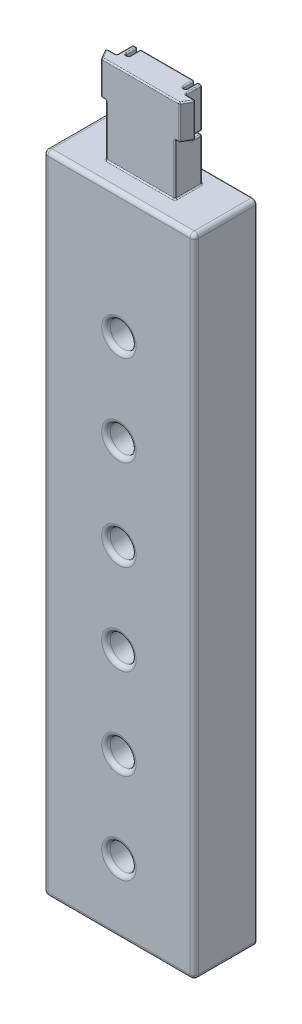
from build123d import *

# Parameters (mm, degrees)
SKETCH1_R               = 18
BOSS_EXTRUDE1_DEPTH     = 19
BOSS_EXTRUDE2_START     = -14.5
BOSS_EXTRUDE2_DEPTH     = 14.5
CUT_EXTRUDE2_DEPTH      = 194.386271488
CUT_EXTRUDE2_DEPTH_BACK = 194.386271488
SKETCH4_R               = 3
SKETCH5_R               = 2.25
CUT_EXTRUDE3_DEPTH      = 3
SKETCH6_R               = 1.65
CUT_EXTRUDE4_DEPTH      = 194.775643464
SKETCH7_R               = 2.95
CUT_EXTRUDE5_DEPTH      = 17
CUT_EXTRUDE7_DEPTH      = 194.386271488
CUT_EXTRUDE7_DEPTH_BACK = 194.386271488
SKETCH8_OUTSIDE_W       = 80.782
SKETCH8_OUTSIDE_H       = 254.782
CUT_EXTRUDE8_DEPTH      = 194.340373435
CUT_EXTRUDE8_DEPTH_BACK = 5
SKETCH9_W               = 16
SKETCH9_H               = 20
SKETCH18_W              = 16
SKETCH18_H              = 20
CUT_EXTRUDE13_DEPTH     = 3.2
BOSS_EXTRUDE3_DEPTH     = 8
SKETCH16_W              = 0.75
SKETCH16_H              = 6
CUT_EXTRUDE11_DEPTH     = 10
SKETCH17_W              = 6
SKETCH17_H              = 0.75
CUT_EXTRUDE12_DEPTH     = 1.75
FILLET2_R               = 0.3
FILLET1_R               = 1


with BuildPart() as part:
    # Sketch1 → Boss-Extrude1 (new body)
    with BuildSketch(Plane.XY):
        Circle(SKETCH1_R)
    extrude(amount=BOSS_EXTRUDE1_DEPTH)

    # Sketch3 → Boss-Extrude2 (add)
    with BuildSketch(Plane.XY.offset(19).offset(BOSS_EXTRUDE2_START)):
        with BuildLine():
            Line((-17.5, -4.213074887), (-17.5, -192))
            Line((-17.5, -192), (17.5, -192))
            Line((17.5, -192), (17.5, -4.213074887))
            ThreePointArc((17.5, -4.213074887), (0, -18), (-17.5, -4.213074887))
        make_face()
    extrude(amount=BOSS_EXTRUDE2_DEPTH)

    # Sketch4 → Cut-Extrude2 (cut, two sides: drawn at the far end of the back side and taken through both)
    with BuildSketch(Plane(origin=(0, 0, 4.5), x_dir=(-1, 0, 0), z_dir=(0, 0, -1)).offset(-CUT_EXTRUDE2_DEPTH_BACK)):
        with Locations((0, -71)):
            Circle(SKETCH4_R)
        with Locations((0, -92)):
            Circle(SKETCH4_R)
        with Locations((0, -113)):
            Circle(SKETCH4_R)
        with Locations((0, -134)):
            Circle(SKETCH4_R)
        with Locations((0, -155)):
            Circle(SKETCH4_R)
        with Locations((0, -176)):
            Circle(SKETCH4_R)
    extrude(amount=CUT_EXTRUDE2_DEPTH + CUT_EXTRUDE2_DEPTH_BACK, mode=Mode.SUBTRACT)

    # Sketch5 → Cut-Extrude3 (cut)
    with BuildSketch(Plane(origin=(0, 0, 0), x_dir=(-1, 0, 0), z_dir=(0, 0, -1))):
        with Locations((-6, 10.392304845)):
            Circle(SKETCH5_R)
        with Locations((12, 0)):
            Circle(SKETCH5_R)
        with Locations((-6, -10.392304845)):
            Circle(SKETCH5_R)
    extrude(amount=-CUT_EXTRUDE3_DEPTH, mode=Mode.SUBTRACT)

    # Sketch6 → Cut-Extrude4 (cut, through all)
    with BuildSketch(Plane(origin=(0, 0, 0), x_dir=(-1, 0, 0), z_dir=(0, 0, -1))):
        with Locations((0, 13.5)):
            Circle(SKETCH6_R)
        with Locations((11.691342951, 6.75)):
            Circle(SKETCH6_R)
        with Locations((11.691342951, -6.75)):
            Circle(SKETCH6_R)
        with Locations((0, -13.5)):
            Circle(SKETCH6_R)
        with Locations((-11.691342951, -6.75)):
            Circle(SKETCH6_R)
        with Locations((-11.691342951, 6.75)):
            Circle(SKETCH6_R)
    extrude(amount=-CUT_EXTRUDE4_DEPTH, mode=Mode.SUBTRACT)

    # Sketch7 → Cut-Extrude5 (cut)
    with BuildSketch(Plane.XY.offset(19)):
        with Locations((0, 13.5)):
            Circle(SKETCH7_R)
        with Locations((11.691342951, 6.75)):
            Circle(SKETCH7_R)
        with Locations((11.691342951, -6.75)):
            Circle(SKETCH7_R)
        with Locations((0, -13.5)):
            Circle(SKETCH7_R)
        with Locations((-11.691342951, -6.75)):
            Circle(SKETCH7_R)
        with Locations((-11.691342951, 6.75)):
            Circle(SKETCH7_R)
    extrude(amount=-CUT_EXTRUDE5_DEPTH, mode=Mode.SUBTRACT)

    # Sketch8 outside → Cut-Extrude7 (cut, two sides: drawn at the far end of the back side and taken through both)
    with BuildSketch(Plane(origin=(0, 0, 4.5), x_dir=(-1, 0, 0), z_dir=(0, 0, -1)).offset(-CUT_EXTRUDE7_DEPTH_BACK)):
        with Locations((0, -87)):
            Rectangle(SKETCH8_OUTSIDE_W, SKETCH8_OUTSIDE_H)
        Polygon((-17.5, -192), (17.5, -192), (17.5, -42), (8, -42), (8, -22), (-8, -22), (-8, -42), (-17.5, -42), align=None, mode=Mode.SUBTRACT)
    extrude(amount=CUT_EXTRUDE7_DEPTH + CUT_EXTRUDE7_DEPTH_BACK, mode=Mode.SUBTRACT)

    # Sketch9 → Cut-Extrude8 (cut, two sides: drawn at the far end of the back side and taken through both)
    with BuildSketch(Plane.XY.offset(19).offset(-CUT_EXTRUDE8_DEPTH_BACK)):
        with Locations((0, -32)):
            Rectangle(SKETCH9_W, SKETCH9_H)
    extrude(amount=CUT_EXTRUDE8_DEPTH + CUT_EXTRUDE8_DEPTH_BACK, mode=Mode.SUBTRACT)

    # Sketch18 → Cut-Extrude13 (cut)
    with BuildSketch(Plane(origin=(0, 0, 4.5), x_dir=(-1, 0, 0), z_dir=(0, 0, -1))):
        with Locations((0, -32)):
            Rectangle(SKETCH18_W, SKETCH18_H)
    extrude(amount=-CUT_EXTRUDE13_DEPTH, mode=Mode.SUBTRACT)

    # Sketch10 → Boss-Extrude3 (add)
    with BuildSketch(Plane(origin=(0, -22, 0), x_dir=(1, 0, 0), z_dir=(0, 1, 0))):
        Polygon((8, -14), (9.056624327, -14), (10.5, -11.5), (8, -11.5), align=None)
    boss_extrude3 = extrude(amount=-BOSS_EXTRUDE3_DEPTH)

    # Sketch16 → Cut-Extrude11 (cut)
    with BuildSketch(Plane(origin=(0, -22, 0), x_dir=(1, 0, 0), z_dir=(0, 1, 0))):
        with Locations((6.625, -7.5)):
            Rectangle(SKETCH16_W, SKETCH16_H)
    cut_extrude11 = extrude(amount=-CUT_EXTRUDE11_DEPTH, mode=Mode.SUBTRACT)

    # Sketch17 → Cut-Extrude12 (cut)
    with BuildSketch(Plane(origin=(8, 0, 0), x_dir=(0, 0, -1), z_dir=(1, 0, 0))):
        with Locations((-7.5, -31.625)):
            Rectangle(SKETCH17_W, SKETCH17_H)
    cut_extrude12 = extrude(amount=-CUT_EXTRUDE12_DEPTH, mode=Mode.SUBTRACT)

    # Mirror1: Boss-Extrude3, Cut-Extrude11, Cut-Extrude12 across plane
    add(boss_extrude3.mirror(Plane.ZY))
    add(cut_extrude11.mirror(Plane.ZY), mode=Mode.SUBTRACT)
    add(cut_extrude12.mirror(Plane.ZY), mode=Mode.SUBTRACT)

    # Fillet2
    fillet2_edges = [part.edges().sort_by_distance(p)[0] for p in [
        (17.5, -117, 4.5),
        (-17.5, -117, 4.5),
        (0, -42, 4.5),
        (-8, -42, 10.85),
        (8, -42, 10.85),
        (0, -42, 14),
        (8, -36, 14),
        (0, -22, 14),
        (8, -26.625, 7.7),
        (-7.5, -22, 7.7),
        (-8, -37, 7.7),
        (0, -42, 7.7),
        (8, -22, 9.6),
        (8, -30, 12.75),
        (9.25, -30, 11.5),
        (8, -26, 11.5),
        (9.778312164, -30, 12.75),
        (10.5, -26, 11.5),
        (8.528312164, -30, 14),
        (9.056624327, -26, 14),
        (9.778312164, -22, 12.75),
        (9.25, -22, 11.5),
        (7.5, -22, 7.7),
        (7.125, -32, 7.7),
        (7, -26.625, 7.7),
        (6.25, -27, 7.7),
        (6.25, -27, 10.5),
        (6.25, -22, 9.1),
        (6.625, -22, 10.5),
        (7, -22, 9.1),
        (6.25, -32, 9.1),
        (7.125, -32, 10.5),
        (7, -26.625, 10.5),
        (8, -37, 7.7),
        (7.5, -31.25, 7.7),
        (8, -31.25, 9.1),
        (8, -31.625, 10.5),
        (8, -32, 9.1),
        (7, -31.25, 9.1),
        (7.5, -31.25, 10.5),
        (-8, -36, 14),
        (-8, -22, 9.6),
        (-8, -26, 11.5),
        (-9.778312164, -22, 12.75),
        (-9.056624327, -26, 14),
        (-9.25, -22, 11.5),
        (-10.5, -26, 11.5),
        (-8, -30, 12.75),
        (-8.528312164, -30, 14),
        (-9.778312164, -30, 12.75),
        (-9.25, -30, 11.5),
        (0, -22, 7.7),
        (-6.25, -22, 9.1),
        (-7.125, -32, 7.7),
        (-7, -22, 9.1),
        (-7, -26.625, 7.7),
        (-7.125, -32, 10.5),
        (-6.25, -27, 10.5),
        (-6.625, -22, 10.5),
        (-6.25, -32, 9.1),
        (-6.25, -27, 7.7),
        (-7, -26.625, 10.5),
        (-8, -26.625, 7.7),
        (-8, -32, 9.1),
        (-7.5, -31.25, 10.5),
        (-8, -31.625, 10.5),
        (-7, -31.25, 9.1),
        (-7.5, -31.25, 7.7),
        (-8, -31.25, 9.1),
        (0, -192, 4.5),
    ]]
    fillet(fillet2_edges, radius=FILLET2_R)

    # Fillet1
    # the kernel refuses this fillet: 1 mm, written as the material it takes off along each edge
    with BuildSketch(Plane(origin=(16.5, -43, 4.5), x_dir=(0, 1, 0), z_dir=(-1, 0, 0))) as fillet1_piece_1:
        with BuildLine():
            CenterArc((0.7, -0.3), 0.3, 0, 90)
            Line((1, -0.3), (1, 0))
            Line((1, 0), (0.7, 0))
        make_face()
    revolve(axis=Axis((16.5, -43, 4.5), (0, 0, -1)), revolution_arc=90, mode=Mode.SUBTRACT)
    with BuildSketch(Plane(origin=(16.5, -191, 4.5), x_dir=(1, 0, 0), z_dir=(0, 1, 0))) as fillet1_piece_2:
        with BuildLine():
            CenterArc((0.7, -0.3), 0.3, 0, 90)
            Line((1, -0.3), (1, 0))
            Line((1, 0), (0.7, 0))
        make_face()
    revolve(axis=Axis((16.5, -191, 4.5), (0, 0, -1)), revolution_arc=90, mode=Mode.SUBTRACT)
    with BuildSketch(Plane(origin=(-16.5, -43, 4.5), x_dir=(-1, 0, 0), z_dir=(0, -1, 0))) as fillet1_piece_3:
        with BuildLine():
            CenterArc((0.7, -0.3), 0.3, 0, 90)
            Line((1, -0.3), (1, 0))
            Line((1, 0), (0.7, 0))
        make_face()
    revolve(axis=Axis((-16.5, -43, 4.5), (0, 0, -1)), revolution_arc=90, mode=Mode.SUBTRACT)
    with BuildSketch(Plane(origin=(-16.5, -191, 4.5), x_dir=(0, -1, 0), z_dir=(1, 0, 0))) as fillet1_piece_4:
        with BuildLine():
            CenterArc((0.7, -0.3), 0.3, 0, 90)
            Line((1, -0.3), (1, 0))
            Line((1, 0), (0.7, 0))
        make_face()
    revolve(axis=Axis((-16.5, -191, 4.5), (0, 0, -1)), revolution_arc=90, mode=Mode.SUBTRACT)
    with BuildSketch(Plane(origin=(-16.5, -191, 18), x_dir=(-1, 0, 0), z_dir=(0, -1, 0))) as fillet1_piece_5_section:
        Polygon((0, 0), (FILLET1_R, 0), (FILLET1_R, -FILLET1_R), (0, -FILLET1_R), align=None)
    fillet1_piece_5 = extrude(amount=FILLET1_R, mode=Mode.PRIVATE)
    fillet1_piece_5 = fillet1_piece_5 - Plane(origin=(-16.5, -191, 18), x_dir=(0.7071067811865475, 0, -0.7071067811865475), z_dir=(0, -1, 0)) * Sphere(FILLET1_R, mode=Mode.PRIVATE)
    add(fillet1_piece_5, mode=Mode.SUBTRACT)
    with BuildSketch(Plane(origin=(16.5, -191, 18), x_dir=(0, -1, 0), z_dir=(1, 0, 0))) as fillet1_piece_6_section:
        Polygon((0, 0), (FILLET1_R, 0), (FILLET1_R, -FILLET1_R), (0, -FILLET1_R), align=None)
    fillet1_piece_6 = extrude(amount=FILLET1_R, mode=Mode.PRIVATE)
    fillet1_piece_6 = fillet1_piece_6 - Plane(origin=(16.5, -191, 18), x_dir=(0, 0.7071067811865475, -0.7071067811865475), z_dir=(1, 0, 0)) * Sphere(FILLET1_R, mode=Mode.PRIVATE)
    add(fillet1_piece_6, mode=Mode.SUBTRACT)
    with BuildSketch(Plane(origin=(-16.5, -43, 18), x_dir=(-1, 0, 0), z_dir=(0, 1, 0))) as fillet1_piece_7_section:
        Polygon((0, 0), (FILLET1_R, 0), (FILLET1_R, FILLET1_R), (0, FILLET1_R), align=None)
    fillet1_piece_7 = extrude(amount=FILLET1_R, mode=Mode.PRIVATE)
    fillet1_piece_7 = fillet1_piece_7 - Plane(origin=(-16.5, -43, 18), x_dir=(0.7071067811865475, 0, -0.7071067811865475), z_dir=(0, 1, 0)) * Sphere(FILLET1_R, mode=Mode.PRIVATE)
    add(fillet1_piece_7, mode=Mode.SUBTRACT)
    with BuildSketch(Plane(origin=(16.5, -43, 18), x_dir=(0, 1, 0), z_dir=(1, 0, 0))) as fillet1_piece_8_section:
        Polygon((0, 0), (FILLET1_R, 0), (FILLET1_R, FILLET1_R), (0, FILLET1_R), align=None)
    fillet1_piece_8 = extrude(amount=FILLET1_R, mode=Mode.PRIVATE)
    fillet1_piece_8 = fillet1_piece_8 - Plane(origin=(16.5, -43, 18), x_dir=(0, -0.7071067811865475, -0.7071067811865475), z_dir=(1, 0, 0)) * Sphere(FILLET1_R, mode=Mode.PRIVATE)
    add(fillet1_piece_8, mode=Mode.SUBTRACT)
    with BuildSketch(Plane(origin=(-16.5, -192, 19), x_dir=(0, 0, -1), z_dir=(1, 0, 0)), Plane(origin=(16.5, -42, 19), x_dir=(0, 0, -1), z_dir=(-1, 0, 0))) as fillet1_piece_9:
        with BuildLine():
            CenterArc((FILLET1_R, FILLET1_R), FILLET1_R, 180, 90)
            Line((0, FILLET1_R), (0, 0))
            Line((0, 0), (FILLET1_R, 0))
        make_face()
    extrude(amount=33, mode=Mode.SUBTRACT)
    with BuildSketch(Plane(origin=(-17.5, -43, 19), x_dir=(0, 0, -1), z_dir=(0, -1, 0)), Plane(origin=(17.5, -191, 19), x_dir=(0, 0, -1), z_dir=(0, 1, 0))) as fillet1_piece_10:
        with BuildLine():
            CenterArc((FILLET1_R, FILLET1_R), FILLET1_R, 180, 90)
            Line((0, FILLET1_R), (0, 0))
            Line((0, 0), (FILLET1_R, 0))
        make_face()
    extrude(amount=148, mode=Mode.SUBTRACT)
    with BuildSketch(Plane(origin=(17.5, -42, 18), x_dir=(0, -1, 0), z_dir=(0, 0, -1)), Plane(origin=(-17.5, -42, 18), x_dir=(1, 0, 0), z_dir=(0, 0, -1)), Plane(origin=(-17.5, -192, 4.5), x_dir=(1, 0, 0), z_dir=(0, 0, 1)), Plane(origin=(17.5, -192, 4.5), x_dir=(0, 1, 0), z_dir=(0, 0, 1))) as fillet1_piece_11:
        with BuildLine():
            CenterArc((FILLET1_R, FILLET1_R), FILLET1_R, 180, 90)
            Line((0, FILLET1_R), (0, 0))
            Line((0, 0), (FILLET1_R, 0))
        make_face()
    extrude(amount=13.5, mode=Mode.SUBTRACT)
    with BuildSketch(Plane(origin=(0, -71, 19), x_dir=(-1, 0, 0), z_dir=(0, -1, 0))) as fillet1_piece_12:
        with BuildLine():
            CenterArc((3 + FILLET1_R, FILLET1_R), FILLET1_R, 180, 90)
            Line((3 + FILLET1_R, 0), (3, 0))
            Line((3, 0), (3, FILLET1_R))
        make_face()
    revolve(axis=Axis((0, -71, 19), (0, 0, -1)), mode=Mode.SUBTRACT)
    with BuildSketch(Plane(origin=(0, -71, 4.5), x_dir=(-1, 0, 0), z_dir=(0, -1, 0))) as fillet1_piece_13:
        with BuildLine():
            CenterArc((3 + FILLET1_R, -FILLET1_R), FILLET1_R, 90, 90)
            Line((3, -FILLET1_R), (3, 0))
            Line((3, 0), (3 + FILLET1_R, 0))
        make_face()
    revolve(axis=Axis((0, -71, 4.5), (0, 0, -1)), mode=Mode.SUBTRACT)
    with BuildSketch(Plane(origin=(0, -92, 19), x_dir=(-1, 0, 0), z_dir=(0, -1, 0))) as fillet1_piece_14:
        with BuildLine():
            CenterArc((3 + FILLET1_R, FILLET1_R), FILLET1_R, 180, 90)
            Line((3 + FILLET1_R, 0), (3, 0))
            Line((3, 0), (3, FILLET1_R))
        make_face()
    revolve(axis=Axis((0, -92, 19), (0, 0, -1)), mode=Mode.SUBTRACT)
    with BuildSketch(Plane(origin=(0, -92, 4.5), x_dir=(-1, 0, 0), z_dir=(0, -1, 0))) as fillet1_piece_15:
        with BuildLine():
            CenterArc((3 + FILLET1_R, -FILLET1_R), FILLET1_R, 90, 90)
            Line((3, -FILLET1_R), (3, 0))
            Line((3, 0), (3 + FILLET1_R, 0))
        make_face()
    revolve(axis=Axis((0, -92, 4.5), (0, 0, -1)), mode=Mode.SUBTRACT)
    with BuildSketch(Plane(origin=(0, -113, 19), x_dir=(-1, 0, 0), z_dir=(0, -1, 0))) as fillet1_piece_16:
        with BuildLine():
            CenterArc((3 + FILLET1_R, FILLET1_R), FILLET1_R, 180, 90)
            Line((3 + FILLET1_R, 0), (3, 0))
            Line((3, 0), (3, FILLET1_R))
        make_face()
    revolve(axis=Axis((0, -113, 19), (0, 0, -1)), mode=Mode.SUBTRACT)
    with BuildSketch(Plane(origin=(0, -113, 4.5), x_dir=(-1, 0, 0), z_dir=(0, -1, 0))) as fillet1_piece_17:
        with BuildLine():
            CenterArc((3 + FILLET1_R, -FILLET1_R), FILLET1_R, 90, 90)
            Line((3, -FILLET1_R), (3, 0))
            Line((3, 0), (3 + FILLET1_R, 0))
        make_face()
    revolve(axis=Axis((0, -113, 4.5), (0, 0, -1)), mode=Mode.SUBTRACT)
    with BuildSketch(Plane(origin=(0, -134, 19), x_dir=(-1, 0, 0), z_dir=(0, -1, 0))) as fillet1_piece_18:
        with BuildLine():
            CenterArc((3 + FILLET1_R, FILLET1_R), FILLET1_R, 180, 90)
            Line((3 + FILLET1_R, 0), (3, 0))
            Line((3, 0), (3, FILLET1_R))
        make_face()
    revolve(axis=Axis((0, -134, 19), (0, 0, -1)), mode=Mode.SUBTRACT)
    with BuildSketch(Plane(origin=(0, -134, 4.5), x_dir=(-1, 0, 0), z_dir=(0, -1, 0))) as fillet1_piece_19:
        with BuildLine():
            CenterArc((3 + FILLET1_R, -FILLET1_R), FILLET1_R, 90, 90)
            Line((3, -FILLET1_R), (3, 0))
            Line((3, 0), (3 + FILLET1_R, 0))
        make_face()
    revolve(axis=Axis((0, -134, 4.5), (0, 0, -1)), mode=Mode.SUBTRACT)
    with BuildSketch(Plane(origin=(0, -155, 19), x_dir=(-1, 0, 0), z_dir=(0, -1, 0))) as fillet1_piece_20:
        with BuildLine():
            CenterArc((3 + FILLET1_R, FILLET1_R), FILLET1_R, 180, 90)
            Line((3 + FILLET1_R, 0), (3, 0))
            Line((3, 0), (3, FILLET1_R))
        make_face()
    revolve(axis=Axis((0, -155, 19), (0, 0, -1)), mode=Mode.SUBTRACT)
    with BuildSketch(Plane(origin=(0, -155, 4.5), x_dir=(-1, 0, 0), z_dir=(0, -1, 0))) as fillet1_piece_21:
        with BuildLine():
            CenterArc((3 + FILLET1_R, -FILLET1_R), FILLET1_R, 90, 90)
            Line((3, -FILLET1_R), (3, 0))
            Line((3, 0), (3 + FILLET1_R, 0))
        make_face()
    revolve(axis=Axis((0, -155, 4.5), (0, 0, -1)), mode=Mode.SUBTRACT)
    with BuildSketch(Plane(origin=(0, -176, 19), x_dir=(-1, 0, 0), z_dir=(0, -1, 0))) as fillet1_piece_22:
        with BuildLine():
            CenterArc((3 + FILLET1_R, FILLET1_R), FILLET1_R, 180, 90)
            Line((3 + FILLET1_R, 0), (3, 0))
            Line((3, 0), (3, FILLET1_R))
        make_face()
    revolve(axis=Axis((0, -176, 19), (0, 0, -1)), mode=Mode.SUBTRACT)
    with BuildSketch(Plane(origin=(0, -176, 4.5), x_dir=(-1, 0, 0), z_dir=(0, -1, 0))) as fillet1_piece_23:
        with BuildLine():
            CenterArc((3 + FILLET1_R, -FILLET1_R), FILLET1_R, 90, 90)
            Line((3, -FILLET1_R), (3, 0))
            Line((3, 0), (3 + FILLET1_R, 0))
        make_face()
    revolve(axis=Axis((0, -176, 4.5), (0, 0, -1)), mode=Mode.SUBTRACT)


solid = part.part
